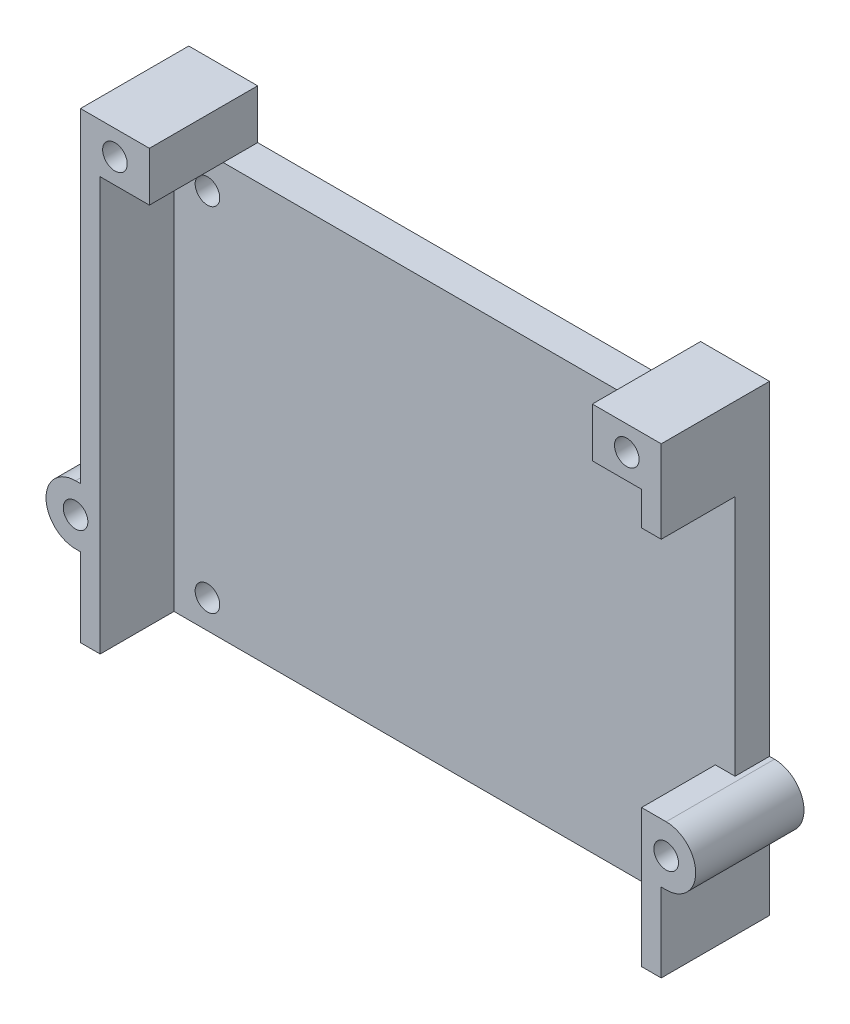
from build123d import *

# Parameters (mm, degrees)
BOSS_EXTRUDE1_DEPTH = 42
SKETCH2_W           = 7.5
SKETCH2_H           = 24.6
CUT_EXTRUDE1_DEPTH  = 10
BOSS_EXTRUDE2_DEPTH = 11
CUT_EXTRUDE2_DEPTH  = 11
SKETCH4_W           = 7
SKETCH4_H           = 11
BOSS_EXTRUDE3_DEPTH = 5
SKETCH5_R           = 1.25
CUT_EXTRUDE3_DEPTH  = 79.969930986
SKETCH7_R           = 1.25
CUT_EXTRUDE4_DEPTH  = 10


with BuildPart() as part:
    # Sketch1 → Boss-Extrude1 (new body)
    with BuildSketch(Plane(origin=(0, 0, 0), x_dir=(1, 0, 0), z_dir=(0, 1, 0))):
        Polygon((0, 0), (2, 0), (2, 7.5), (57, 7.5), (57, 0), (59, 0), (59, 11), (0, 11), align=None)
    extrude(amount=BOSS_EXTRUDE1_DEPTH)

    # Sketch2 → Cut-Extrude1 (cut)
    with BuildSketch(Plane(origin=(59, 0, 0), x_dir=(0, 0, -1), z_dir=(1, 0, 0))):
        with Locations((3.75, 26.3)):
            Rectangle(SKETCH2_W, SKETCH2_H)
    extrude(amount=-CUT_EXTRUDE1_DEPTH, mode=Mode.SUBTRACT)

    # Sketch3 → Boss-Extrude2 (add)
    with BuildSketch(Plane(origin=(0, 0, -11), x_dir=(-1, 0, 0), z_dir=(0, 0, -1))):
        with BuildLine():
            Line((-59, 12.145643924), (-59, 14))
            Line((-59, 14), (-59.5, 14))
            ThreePointArc((-59.5, 14), (-62.5, 11), (-59.5, 8))
            Line((-59.5, 8), (-59, 8))
            Line((-59, 8), (-59, 9.854356076))
            ThreePointArc((-59, 9.854356076), (-60.75, 11), (-59, 12.145643924))
        make_face()
        with BuildLine():
            Line((0.5, 14), (0, 14))
            Line((0, 14), (0, 12.145643924))
            ThreePointArc((0, 12.145643924), (1.75, 11), (0, 9.854356076))
            Line((0, 9.854356076), (0, 8))
            Line((0, 8), (0.5, 8))
            ThreePointArc((0.5, 8), (3.5, 11), (0.5, 14))
        make_face()
    extrude(amount=-BOSS_EXTRUDE2_DEPTH)

    # Sketch3<3> → Cut-Extrude2 (cut)
    with BuildSketch(Plane(origin=(0, 0, -11), x_dir=(-1, 0, 0), z_dir=(0, 0, -1))):
        with BuildLine():
            ThreePointArc((-59, 9.854356076), (-58.25, 11), (-59, 12.145643924))
            Line((-59, 12.145643924), (-59, 9.854356076))
        make_face()
        with BuildLine():
            Line((0, 9.854356076), (0, 12.145643924))
            ThreePointArc((0, 12.145643924), (-0.75, 11), (0, 9.854356076))
        make_face()
    extrude(amount=-CUT_EXTRUDE2_DEPTH, mode=Mode.SUBTRACT)

    # Sketch4 → Boss-Extrude3 (add)
    with BuildSketch(Plane(origin=(0, 42, 0), x_dir=(1, 0, 0), z_dir=(0, 1, 0))):
        with Locations((3.5, 5.5)):
            Rectangle(SKETCH4_W, SKETCH4_H)
        with Locations((55.5, 5.5)):
            Rectangle(SKETCH4_W, SKETCH4_H)
    extrude(amount=BOSS_EXTRUDE3_DEPTH)

    # Sketch5 → Cut-Extrude3 (cut, through all)
    with BuildSketch(Plane(origin=(0, 0, -11), x_dir=(-1, 0, 0), z_dir=(0, 0, -1))):
        with Locations((-55.5, 44.5)):
            Circle(SKETCH5_R)
        with Locations((-3.5, 44.5)):
            Circle(SKETCH5_R)
    extrude(amount=-CUT_EXTRUDE3_DEPTH, mode=Mode.SUBTRACT)

    # Sketch7 → Cut-Extrude4 (cut)
    with BuildSketch(Plane(origin=(0, 0, -11), x_dir=(-1, 0, 0), z_dir=(0, 0, -1))):
        with Locations((-5.4, 2.9)):
            Circle(SKETCH7_R)
        with Locations((-53.6, 2.9)):
            Circle(SKETCH7_R)
        with Locations((-53.6, 38.7)):
            Circle(SKETCH7_R)
        with Locations((-5.4, 38.7)):
            Circle(SKETCH7_R)
    extrude(amount=-CUT_EXTRUDE4_DEPTH, mode=Mode.SUBTRACT)


solid = part.part
